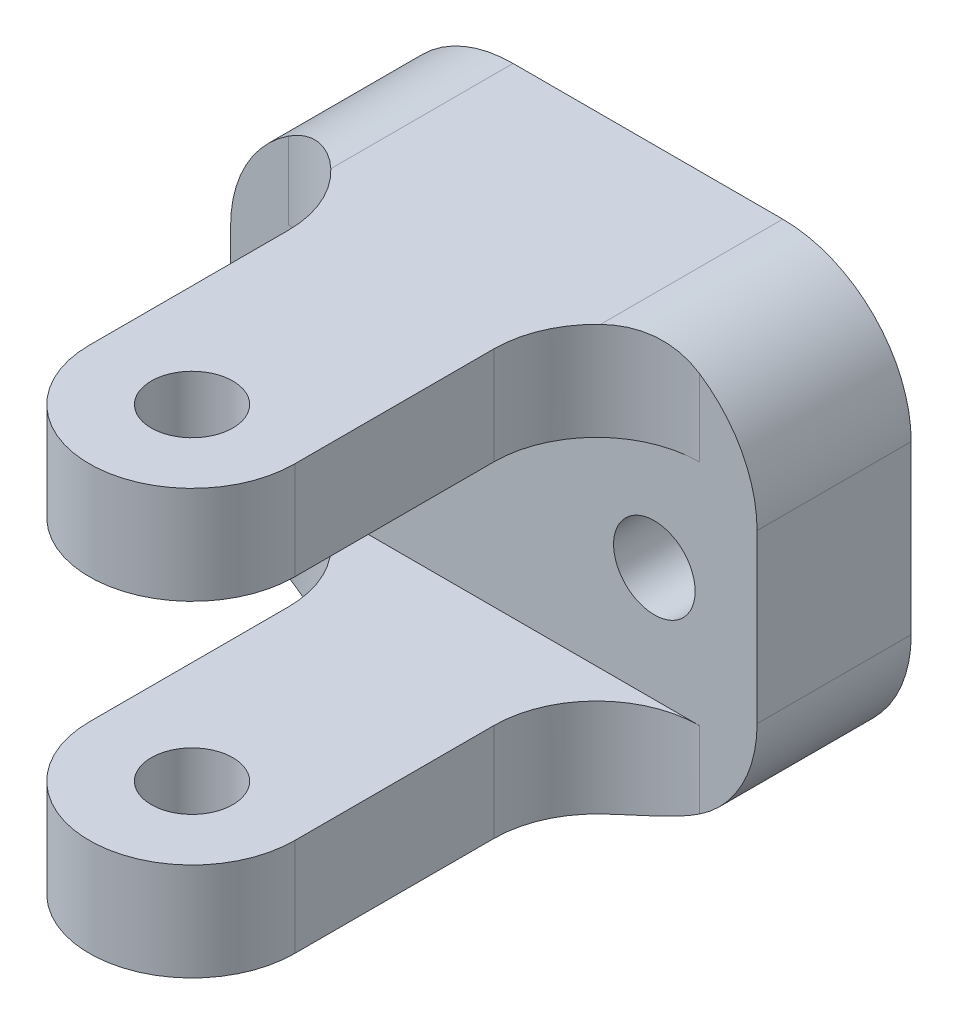
from build123d import *

# Parameters (mm, degrees)
SKETCH1_W                      = 41
SKETCH1_H                      = 33.02
SKETCH1_R                      = 3.175
BOSS_EXTRUDE1_DEPTH            = 12
SKETCH2_W                      = 41
SKETCH2_H                      = 7.62
BOSS_EXTRUDE2_DEPTH            = 53
CUT_EXTRUDE1_REACH             = 72.127
SKETCH4_R                      = 3.175
CUT_EXTRUDE1_DIRECTION_2_REACH = 72.127
CUT_EXTRUDE3_REACH             = 72.127
CUT_EXTRUDE3_DIRECTION_2_REACH = 72.127
FILLET1_R                      = 10


with BuildPart() as part:
    # Sketch1 → Boss-Extrude1 (new body)
    with BuildSketch(Plane.XY):
        Rectangle(SKETCH1_W, SKETCH1_H)
        with Locations((12.5, 0)):
            Circle(SKETCH1_R, mode=Mode.SUBTRACT)
        with Locations((-12.5, 0)):
            Circle(SKETCH1_R, mode=Mode.SUBTRACT)
    extrude(amount=BOSS_EXTRUDE1_DEPTH)

    # Sketch2 → Boss-Extrude2 (add)
    with BuildSketch(Plane.XY.offset(12)):
        with Locations((0, 12.7)):
            Rectangle(SKETCH2_W, SKETCH2_H)
        with Locations((0, -12.7)):
            Rectangle(SKETCH2_W, SKETCH2_H)
    extrude(amount=BOSS_EXTRUDE2_DEPTH)

    # Cut-Extrude1: up to this face of the body (flat: up to its plane)
    cut_extrude1_end = Plane(part.part.faces().sort_by_distance((0, -16.51, 32.5))[0])
    # Sketch4 → Cut-Extrude1 (cut, up to the picked face)
    with BuildSketch(Plane(origin=(0, 0, 0), x_dir=(1, 0, 0), z_dir=(0, 1, 0)), mode=Mode.PRIVATE) as cut_extrude1_sk1:
        with Locations((0, -35.5)):
            Circle(SKETCH4_R)
    cut_extrude1_tool1 = split(extrude(cut_extrude1_sk1.sketch, amount=-CUT_EXTRUDE1_REACH, mode=Mode.PRIVATE), bisect_by=cut_extrude1_end, keep=Keep.BOTH, mode=Mode.PRIVATE)
    add(cut_extrude1_tool1.solids().sort_by(Axis((0, 0, 35.5), (0, -1, 0)))[0], mode=Mode.SUBTRACT)

    # Cut-Extrude1 direction 2: up to this face of the body (flat: up to its plane)
    cut_extrude1_direction_2_end = Plane(part.part.faces().sort_by_distance((0, 16.51, 32.5))[0])
    # Sketch4 → Cut-Extrude1 direction 2 (cut, up to the picked face)
    with BuildSketch(Plane(origin=(0, 0, 0), x_dir=(1, 0, 0), z_dir=(0, 1, 0)), mode=Mode.PRIVATE) as cut_extrude1_direction_2_sk1:
        with Locations((0, -35.5)):
            Circle(SKETCH4_R)
    cut_extrude1_direction_2_tool1 = split(extrude(cut_extrude1_direction_2_sk1.sketch, amount=CUT_EXTRUDE1_DIRECTION_2_REACH, mode=Mode.PRIVATE), bisect_by=cut_extrude1_direction_2_end, keep=Keep.BOTH, mode=Mode.PRIVATE)
    add(cut_extrude1_direction_2_tool1.solids().sort_by(Axis((0, 0, 35.5), (0, 1, 0)))[0], mode=Mode.SUBTRACT)

    # Cut-Extrude3: up to this face of the body (flat: up to its plane)
    cut_extrude3_end = Plane(part.part.faces().sort_by_distance((-19.731494958, -16.51, 32.5))[0])
    # Sketch6 → Cut-Extrude3 (cut, up to the picked face)
    with BuildSketch(Plane(origin=(0, 0, 0), x_dir=(1, 0, 0), z_dir=(0, 1, 0)), mode=Mode.PRIVATE) as cut_extrude3_sk1:
        with BuildLine():
            Line((-8, -35.5), (-8, -20))
            ThreePointArc((-8, -20), (-10.343145751, -14.343145751), (-16, -12))
            Line((-16, -12), (-20.5, -12))
            Line((-20.5, -12), (-20.5, -65))
            Line((-20.5, -65), (20.5, -65))
            Line((20.5, -65), (20.5, -12))
            Line((20.5, -12), (16, -12))
            ThreePointArc((16, -12), (10.343145751, -14.343145751), (8, -20))
            Line((8, -20), (8, -35.5))
            ThreePointArc((8, -35.5), (0, -43.5), (-8, -35.5))
        make_face()
    cut_extrude3_tool1 = split(extrude(cut_extrude3_sk1.sketch, amount=-CUT_EXTRUDE3_REACH, mode=Mode.PRIVATE), bisect_by=cut_extrude3_end, keep=Keep.BOTH, mode=Mode.PRIVATE)
    add(cut_extrude3_tool1.solids().sort_by(Axis((-8.670075, 0, 27.75), (0, -1, 0)))[0], mode=Mode.SUBTRACT)

    # Cut-Extrude3 direction 2: up to this face of the body (flat: up to its plane)
    cut_extrude3_direction_2_end = Plane(part.part.faces().sort_by_distance((19.731494958, 16.51, 32.5))[0])
    # Sketch6 → Cut-Extrude3 direction 2 (cut, up to the picked face)
    with BuildSketch(Plane(origin=(0, 0, 0), x_dir=(1, 0, 0), z_dir=(0, 1, 0)), mode=Mode.PRIVATE) as cut_extrude3_direction_2_sk1:
        with BuildLine():
            Line((-8, -35.5), (-8, -20))
            ThreePointArc((-8, -20), (-10.343145751, -14.343145751), (-16, -12))
            Line((-16, -12), (-20.5, -12))
            Line((-20.5, -12), (-20.5, -65))
            Line((-20.5, -65), (20.5, -65))
            Line((20.5, -65), (20.5, -12))
            Line((20.5, -12), (16, -12))
            ThreePointArc((16, -12), (10.343145751, -14.343145751), (8, -20))
            Line((8, -20), (8, -35.5))
            ThreePointArc((8, -35.5), (0, -43.5), (-8, -35.5))
        make_face()
    cut_extrude3_direction_2_tool1 = split(extrude(cut_extrude3_direction_2_sk1.sketch, amount=CUT_EXTRUDE3_DIRECTION_2_REACH, mode=Mode.PRIVATE), bisect_by=cut_extrude3_direction_2_end, keep=Keep.BOTH, mode=Mode.PRIVATE)
    add(cut_extrude3_direction_2_tool1.solids().sort_by(Axis((-8.670075, 0, 27.75), (0, 1, 0)))[0], mode=Mode.SUBTRACT)

    # Fillet1
    fillet1_edges = [part.edges().sort_by_distance(p)[0] for p in [
        (-20.5, -16.51, 6),
        (-20.5, 16.51, 6),
        (20.5, -16.51, 6),
        (20.5, 16.51, 6),
    ]]
    fillet(fillet1_edges, radius=FILLET1_R)


solid = part.part
